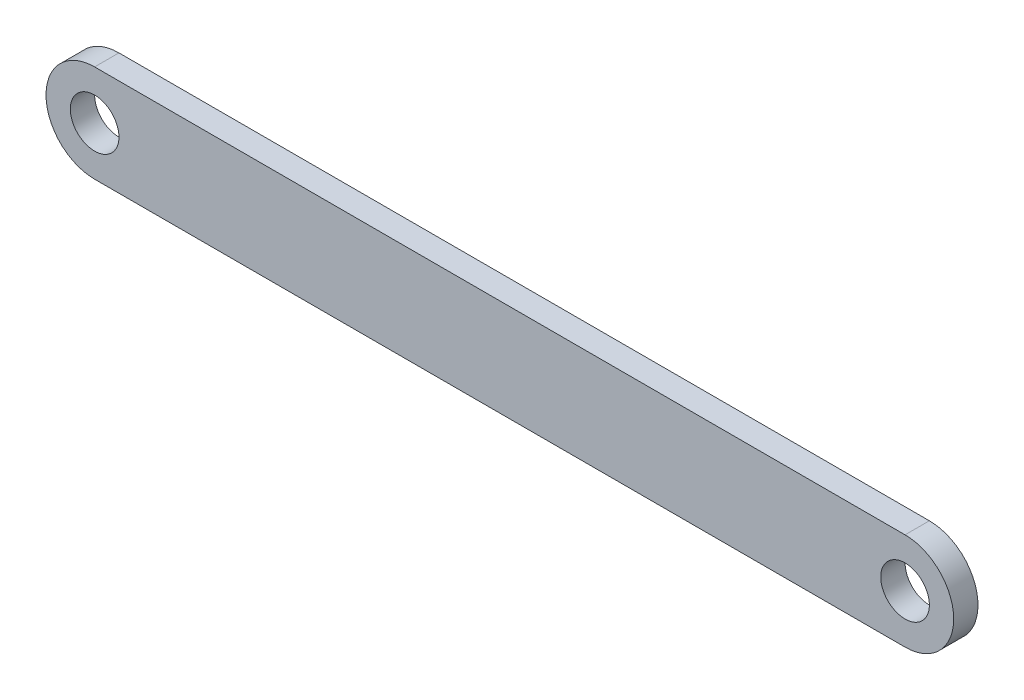
from build123d import *

# Parameters (mm, degrees)
SKETCH1_R           = 3
BOSS_EXTRUDE1_DEPTH = 3


with BuildPart() as part:
    # Sketch1 → Boss-Extrude1 (new body)
    with BuildSketch(Plane.XY):
        with BuildLine():
            Line((-50, 6), (50, 6))
            ThreePointArc((50, 6), (56, 0), (50, -6))
            Line((50, -6), (-50, -6))
            ThreePointArc((-50, -6), (-56, 0), (-50, 6))
        make_face()
        with Locations((-50, 0)):
            Circle(SKETCH1_R, mode=Mode.SUBTRACT)
        with Locations((50, 0)):
            Circle(SKETCH1_R, mode=Mode.SUBTRACT)
    extrude(amount=BOSS_EXTRUDE1_DEPTH)


solid = part.part
